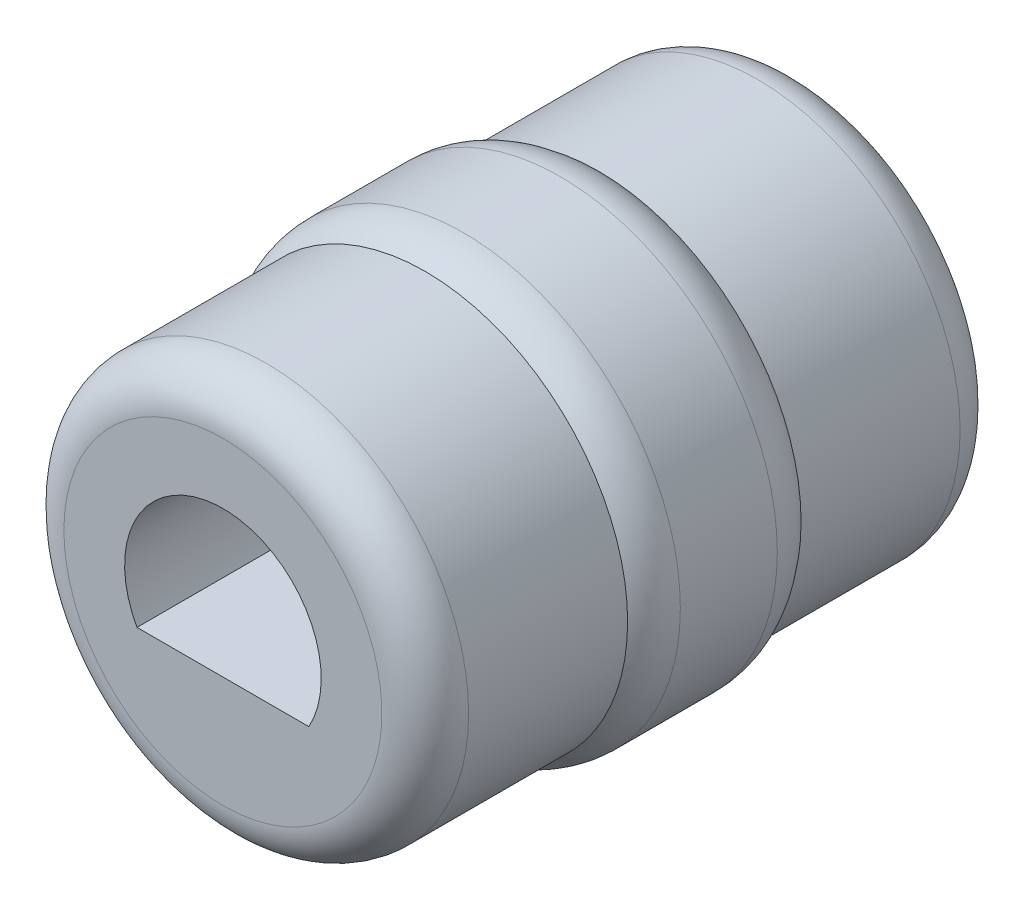
from build123d import *
from build123d.topology import SkipClean

# Parameters (mm, degrees)
ESBO_O1_W                  = 14
ESBO_O1_H                  = 20
ESBO_O1_R                  = 1.25
RESSALTO_EXTRUS_O1_DEPTH   = 14
ESBO_O6_R                  = 2.75
CORTE_EXTRUS_O3_DEPTH      = 10
CORTE_EXTRUS_O5_DEPTH      = 10
CORTE_EXTRUS_O5_DEPTH_BACK = 10
ESBO_O3_R                  = 1.25
ESBO_O8_R                  = 3.05
CORTE_EXTRUS_O6_DEPTH      = 10
ESBO_O9_OUTSIDE_W          = 21.628
ESBO_O9_OUTSIDE_H          = 21.628
ESBO_O9_OUTSIDE_R          = 7
CORTE_EXTRUS_O7_DEPTH      = 26.396850332
RESSALTO_EXTRUS_O2_START   = -6.122497316
RESSALTO_EXTRUS_O2_DEPTH   = 2.244994532
RESSALTO_EXTRUS_O3_DEPTH   = 10
ESBO_O13_R                 = 1.3
CORTE_EXTRUS_O8_DEPTH      = 16
RESSALTO_EXTRUS_O4_DEPTH   = 10
ESBO_O15_R                 = 1.3
CORTE_EXTRUS_O9_DEPTH      = 7
ESBO_O16_R                 = 7.5
ESBO_O16_R_2               = 7
RESSALTO_EXTRUS_O5_DEPTH   = 3
FILETE2_R                  = 2
FILETE3_R                  = 2
RESSALTO_EXTRUS_O6_START   = 10
RESSALTO_EXTRUS_O6_DEPTH   = 10
CORTE_EXTRUS_O11_DEPTH     = 10
CORTE_EXTRUS_O12_DEPTH     = 10
RESSALTO_EXTRUS_O8_DEPTH   = 10
RESSALTO_EXTRUS_O9_DEPTH   = 10
RESSALTO_EXTRUS_O10_DEPTH  = 10
ESBO_O26_R                 = 7
ESBO_O26_R_2               = 3.45
RESSALTO_EXTRUS_O11_DEPTH  = 20
FILETE4_R                  = 1.5
FILETE5_R                  = 1.5
ESBO_O27_W                 = 5.34202784
ESBO_O27_H                 = 3.157877353
RESSALTO_EXTRUS_O12_DEPTH  = 8


# Read off the part's stored shape, not the designer's step: Ressalto-extrusão2
with BuildPart() as part:
    # Esboço1 → Ressalto-extrusão1 (new body)
    with BuildSketch(Plane(origin=(0, 0, 0), x_dir=(1, 0, 0), z_dir=(0, 1, 0))):
        Rectangle(ESBO_O1_W, ESBO_O1_H)
        with Locations(Location((0, 5, 0), (0, 0, 270))):
            Circle(ESBO_O1_R, mode=Mode.SUBTRACT)
    extrude(amount=RESSALTO_EXTRUS_O1_DEPTH)

    # Esboço6 → Corte-extrusão3 (cut)
    with BuildSketch(Plane(origin=(0, 0, -10), x_dir=(-1, 0, 0), z_dir=(0, 0, -1))):
        with Locations((0, 7)):
            Circle(ESBO_O6_R)
    extrude(amount=-CORTE_EXTRUS_O3_DEPTH, mode=Mode.SUBTRACT)

    # Esboço3 → Corte-extrusão5 (cut, two sides: drawn at the far end of the back side and taken through both)
    with BuildSketch(Plane(origin=(0, 0, 0), x_dir=(1, 0, 0), z_dir=(0, 1, 0)).offset(-CORTE_EXTRUS_O5_DEPTH_BACK)):
        with Locations(Location((0, -5, 0), (0, 0, 270))):
            Circle(ESBO_O3_R)
    extrude(amount=CORTE_EXTRUS_O5_DEPTH + CORTE_EXTRUS_O5_DEPTH_BACK, mode=Mode.SUBTRACT)

    # Esboço8 → Corte-extrusão6 (cut)
    with BuildSketch(Plane.XY.offset(10)):
        with Locations((0, 7)):
            Circle(ESBO_O8_R)
    extrude(amount=-CORTE_EXTRUS_O6_DEPTH, mode=Mode.SUBTRACT)

    # Esboço9 outside → Corte-extrusão7 (cut, through all)
    with BuildSketch(Plane.XY.offset(10)):
        with Locations((0, 7)):
            Rectangle(ESBO_O9_OUTSIDE_W, ESBO_O9_OUTSIDE_H)
        with Locations((0, 7)):
            Circle(ESBO_O9_OUTSIDE_R, mode=Mode.SUBTRACT)
    extrude(amount=-CORTE_EXTRUS_O7_DEPTH, mode=Mode.SUBTRACT)

    # Ressalto-extrusão2 outline → Ressalto-extrusão2 (add)
    with SkipClean():  # the faces are left unmerged after this step: merging them gives an invalid solid
        with BuildSketch(Plane.XY.offset(10).offset(RESSALTO_EXTRUS_O2_START)):
            with BuildLine():
                ThreePointArc((0.55, 10), (2.343074903, 8.952562419), (3.05, 7))
                Line((3.05, 7), (7, 7))
                ThreePointArc((7, 7), (0, 14), (-7, 7))
                Line((-7, 7), (-3.05, 7))
                ThreePointArc((-3.05, 7), (-2.343074903, 8.952562419), (-0.55, 10))
                ThreePointArc((-0.55, 10), (0, 10.05), (0.55, 10))
            make_face()
        extrude(amount=RESSALTO_EXTRUS_O2_DEPTH)

    # Esboço11 → Ressalto-extrusão3 (add)
    with SkipClean():  # the faces are left unmerged after this step: merging them gives an invalid solid
        with BuildSketch(Plane(origin=(0, 0, -10), x_dir=(-1, 0, 0), z_dir=(0, 0, -1))):
            with BuildLine():
                Line((2.079062289, 5.2), (-2.079062289, 5.2))
                ThreePointArc((-2.079062289, 5.2), (0, 4.25), (2.079062289, 5.2))
            make_face()
            with BuildLine():
                ThreePointArc((2.079062289, 8.8), (0, 9.75), (-2.079062289, 8.8))
                Line((-2.079062289, 8.8), (2.079062289, 8.8))
            make_face()
        extrude(amount=-RESSALTO_EXTRUS_O3_DEPTH)

    # Esboço13 → Corte-extrusão8 (cut)
    with BuildSketch(Plane(origin=(0, 0, 0), x_dir=(1, 0, 0), z_dir=(0, 1, 0))):
        with Locations(Location((0, 5, 0), (0, 0, 90))):
            Circle(ESBO_O13_R)
    extrude(amount=CORTE_EXTRUS_O8_DEPTH, mode=Mode.SUBTRACT)

    # Esboço14 → Ressalto-extrusão4 (add)
    with BuildSketch(Plane.XY.offset(10)):
        with BuildLine():
            Line((0, 3.95), (0, 4.95))
            Line((0, 4.95), (-2.258317958, 4.95))
            ThreePointArc((-2.258317958, 4.95), (-1.234908904, 4.211183047), (0, 3.95))
        make_face()
        with BuildLine():
            Line((2.258317958, 4.95), (0, 4.95))
            Line((0, 4.95), (0, 3.95))
            ThreePointArc((0, 3.95), (1.234908904, 4.211183047), (2.258317958, 4.95))
        make_face()
    extrude(amount=-RESSALTO_EXTRUS_O4_DEPTH)

    # Esboço15 → Corte-extrusão9 (cut)
    with BuildSketch(Plane(origin=(0, 0, 0), x_dir=(1, 0, 0), z_dir=(0, 1, 0))):
        with Locations(Location((0, -5, 0), (0, 0, 90))):
            Circle(ESBO_O15_R)
    extrude(amount=CORTE_EXTRUS_O9_DEPTH, mode=Mode.SUBTRACT)

    # Esboço16 → Ressalto-extrusão5 (add, symmetric)
    with BuildSketch(Plane.XY):
        with Locations((0, 7)):
            Circle(ESBO_O16_R)
        with Locations((0, 7)):
            Circle(ESBO_O16_R_2, mode=Mode.SUBTRACT)
    extrude(amount=RESSALTO_EXTRUS_O5_DEPTH, both=True)

    # Filete2
    # the kernel refuses this fillet: 2 mm, written as the material it takes off along each edge
    with BuildSketch(Plane(origin=(0, 7, 3), x_dir=(1, 0, 0), z_dir=(0, -1, 0))) as filete2_piece_1:
        with BuildLine():
            CenterArc((5.5, -1.322875656), FILETE2_R, 0, 41.409622109)
            Line((7, 0), (7.03, 0.026457513))
            ThreePointArc((7.03, 0.026457513), (7.25, 0.04), (7.5, 0.04))
            Line((7.5, 0.04), (7.54, 0))
            Line((7.54, 0), (7.54, -1.322875656))
            Line((7.54, -1.322875656), (7.5, -1.322875656))
        make_face()
    revolve(axis=Axis((0, 7, 3), (0, 0, 1)), mode=Mode.SUBTRACT)

    # Filete3
    # the kernel refuses this fillet: 2 mm, written as the material it takes off along each edge
    with BuildSketch(Plane(origin=(0, 7, -3), x_dir=(1, 0, 0), z_dir=(0, -1, 0))) as filete3_piece_1:
        with BuildLine():
            CenterArc((5.5, 1.322875656), FILETE3_R, 318.590377891, 41.409622109)
            Line((7.5, 1.322875656), (7.54, 1.322875656))
            Line((7.54, 1.322875656), (7.54, 0))
            Line((7.54, 0), (7.5, -0.04))
            ThreePointArc((7.5, -0.04), (7.25, -0.04), (7.03, -0.026457513))
            Line((7.03, -0.026457513), (7, 0))
        make_face()
    revolve(axis=Axis((0, 7, -3), (0, 0, 1)), mode=Mode.SUBTRACT)

    # Esboço18 → Ressalto-extrusão6 (add)
    with BuildSketch(Plane.XY.offset(RESSALTO_EXTRUS_O6_START)):
        with BuildLine():
            Line((2.46221445, 5.2), (2.079062289, 5.2))
            Line((2.079062289, 5.2), (-2.079062289, 5.2))
            Line((-2.079062289, 5.2), (-2.46221445, 5.2))
            ThreePointArc((-2.46221445, 5.2), (-2.363573895, 5.072302294), (-2.258317958, 4.95))
            Line((-2.258317958, 4.95), (2.258317958, 4.95))
            ThreePointArc((2.258317958, 4.95), (2.363573895, 5.072302294), (2.46221445, 5.2))
        make_face()
    extrude(amount=-RESSALTO_EXTRUS_O6_DEPTH)

    # Esboço19 → Corte-extrusão11 (cut)
    with BuildSketch(Plane.XY.offset(10)):
        with BuildLine():
            ThreePointArc((-2.46221445, 5.2), (0, 10.05), (2.46221445, 5.2))
            Line((2.46221445, 5.2), (3.059820256, 5.2))
            ThreePointArc((3.059820256, 5.2), (0, 10.55), (-3.059820256, 5.2))
            Line((-3.059820256, 5.2), (-2.46221445, 5.2))
        make_face()
    extrude(amount=-CORTE_EXTRUS_O11_DEPTH, mode=Mode.SUBTRACT)

    # Esboço20 → Corte-extrusão12 (cut)
    with BuildSketch(Plane(origin=(0, 0, -10), x_dir=(-1, 0, 0), z_dir=(0, 0, -1))):
        with BuildLine():
            Line((-2.494493937, 4.2), (2.494493937, 4.2))
            ThreePointArc((2.494493937, 4.2), (3.75, 7), (2.494493937, 9.8))
            Line((2.494493937, 9.8), (-2.494493937, 9.8))
            ThreePointArc((-2.494493937, 9.8), (-3.75, 7), (-2.494493937, 4.2))
        make_face()
        with BuildLine():
            Line((-2.079062289, 8.8), (2.079062289, 8.8))
            ThreePointArc((2.079062289, 8.8), (2.75, 7), (2.079062289, 5.2))
            Line((2.079062289, 5.2), (-2.079062289, 5.2))
            ThreePointArc((-2.079062289, 5.2), (-2.75, 7), (-2.079062289, 8.8))
        make_face(mode=Mode.SUBTRACT)
    extrude(amount=-CORTE_EXTRUS_O12_DEPTH, mode=Mode.SUBTRACT)

    # Esboço23 → Ressalto-extrusão8 (add)
    with BuildSketch(Plane(origin=(0, 0, -10), x_dir=(-1, 0, 0), z_dir=(0, 0, -1))):
        with BuildLine():
            Line((-2.494493937, 4.2), (2.494493937, 4.2))
            ThreePointArc((2.494493937, 4.2), (3.75, 7), (2.494493937, 9.8))
            Line((2.494493937, 9.8), (-2.494493937, 9.8))
            ThreePointArc((-2.494493937, 9.8), (-3.75, 7), (-2.494493937, 4.2))
        make_face()
        with BuildLine():
            Line((-2.369493617, 9.48), (2.369493617, 9.48))
            ThreePointArc((2.369493617, 9.48), (3.43, 7), (2.369493617, 4.52))
            Line((2.369493617, 4.52), (-2.369493617, 4.52))
            ThreePointArc((-2.369493617, 4.52), (-3.43, 7), (-2.369493617, 9.48))
        make_face(mode=Mode.SUBTRACT)
    extrude(amount=-RESSALTO_EXTRUS_O8_DEPTH)

    # Esboço24 → Ressalto-extrusão9 (add)
    with BuildSketch(Plane.XY.offset(10)):
        with BuildLine():
            Line((3.059820256, 5.2), (-3.059820256, 5.2))
            ThreePointArc((-3.059820256, 5.2), (0, 10.55), (3.059820256, 5.2))
        make_face()
        with BuildLine():
            Line((2.972793299, 5.35), (-2.972793299, 5.35))
            ThreePointArc((-2.972793299, 5.35), (0, 10.4), (2.972793299, 5.35))
        make_face(mode=Mode.SUBTRACT)
    extrude(amount=-RESSALTO_EXTRUS_O9_DEPTH)

    # Esboço25 → Ressalto-extrusão10 (add)
    with BuildSketch(Plane(origin=(0, 0, -10), x_dir=(-1, 0, 0), z_dir=(0, 0, -1))):
        with BuildLine():
            Line((2.369493617, 9.48), (-2.369493617, 9.48))
            ThreePointArc((-2.369493617, 9.48), (-3.43, 7), (-2.369493617, 4.52))
            Line((-2.369493617, 4.52), (2.369493617, 4.52))
            ThreePointArc((2.369493617, 4.52), (3.43, 7), (2.369493617, 9.48))
        make_face()
        with BuildLine():
            Line((2.245996438, 9.18), (-2.245996438, 9.18))
            ThreePointArc((-2.245996438, 9.18), (-3.13, 7), (-2.245996438, 4.82))
            Line((-2.245996438, 4.82), (2.245996438, 4.82))
            ThreePointArc((2.245996438, 4.82), (3.13, 7), (2.245996438, 9.18))
        make_face(mode=Mode.SUBTRACT)
    extrude(amount=-RESSALTO_EXTRUS_O10_DEPTH)

    # Esboço26 → Ressalto-extrusão11 (add)
    with BuildSketch(Plane.XY.offset(10)):
        with Locations((0, 7)):
            Circle(ESBO_O26_R)
        with Locations((0, 7)):
            Circle(ESBO_O26_R_2, mode=Mode.SUBTRACT)
    extrude(amount=-RESSALTO_EXTRUS_O11_DEPTH)

    # Filete4
    filete4_edges = [part.edges().sort_by_distance(p)[0] for p in [
        (-7, 7, -10),
    ]]
    fillet(filete4_edges, radius=FILETE4_R)

    # Filete5
    filete5_edges = [part.edges().sort_by_distance(p)[0] for p in [
        (-7, 7, 10),
    ]]
    fillet(filete5_edges, radius=FILETE5_R)

    # Esboço27 → Ressalto-extrusão12 (add)
    with BuildSketch(Plane.XY.offset(10)):
        with Locations((0, 3.771061324)):
            Rectangle(ESBO_O27_W, ESBO_O27_H)
    extrude(amount=-RESSALTO_EXTRUS_O12_DEPTH)


solid = part.part
